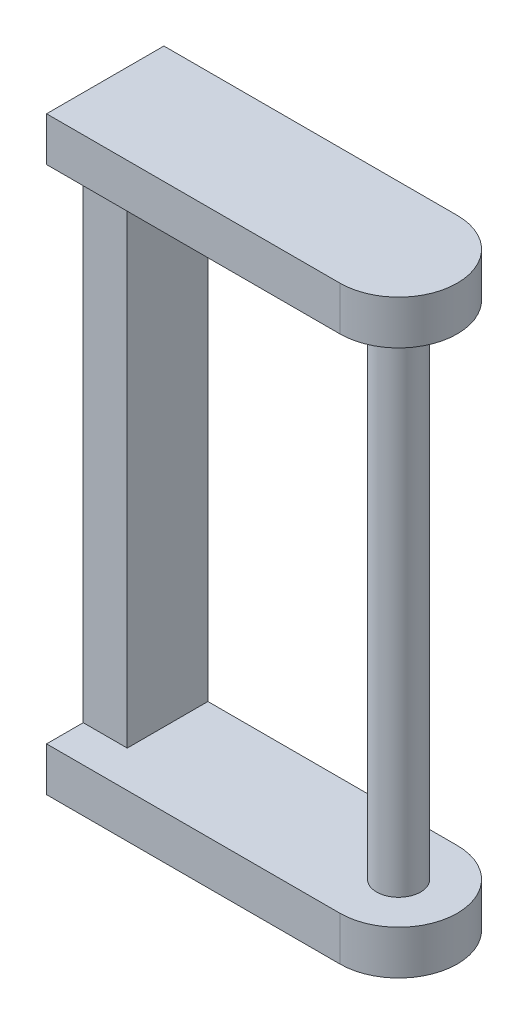
from build123d import *

# Parameters (mm, degrees)
BOSS_EXTRUDE1_DEPTH    = 201
CUT_EXTRUDE1_START     = -40
CUT_EXTRUDE1_OUTLINE_W = 106
CUT_EXTRUDE1_OUTLINE_H = 171
CUT_EXTRUDE1_DEPTH     = 40
SKETCH3_R              = 7.5
BOSS_EXTRUDE2_DEPTH    = 171
SKETCH4_W              = 15
SKETCH4_H              = 171
CUT_EXTRUDE2_DEPTH     = 12.5


# Read off the part's stored shape, not the designer's step: Cut-Extrude1
with BuildPart() as part:
    # Sketch1 → Boss-Extrude1 (new body)
    with BuildSketch(Plane(origin=(0, 0, 0), x_dir=(1, 0, 0), z_dir=(0, 1, 0))):
        with BuildLine():
            Line((-100, 20), (0, 20))
            ThreePointArc((0, 20), (20, 0), (0, -20))
            Line((0, -20), (-100, -20))
            Line((-100, -20), (-100, 20))
        make_face()
    extrude(amount=BOSS_EXTRUDE1_DEPTH)

    # Cut-Extrude1 outline → Cut-Extrude1 (cut)
    with BuildSketch(Plane.XY.offset(20).offset(CUT_EXTRUDE1_START)):
        with Locations((-32, 100.5)):
            Rectangle(CUT_EXTRUDE1_OUTLINE_W, CUT_EXTRUDE1_OUTLINE_H)
    extrude(amount=CUT_EXTRUDE1_DEPTH, mode=Mode.SUBTRACT)

    # Sketch3 → Boss-Extrude2 (add)
    with BuildSketch(Plane(origin=(0, 15, 0), x_dir=(1, 0, 0), z_dir=(0, 1, 0))):
        with Locations(Location((0, 0, 0), (0, 0, 90))):
            Circle(SKETCH3_R)
    extrude(amount=BOSS_EXTRUDE2_DEPTH)

    # Sketch4 → Cut-Extrude2 (cut)
    with BuildSketch(Plane.XY.offset(20)):
        with Locations((-92.5, 100.5)):
            Rectangle(SKETCH4_W, SKETCH4_H)
    extrude(amount=-CUT_EXTRUDE2_DEPTH, mode=Mode.SUBTRACT)


solid = part.part
